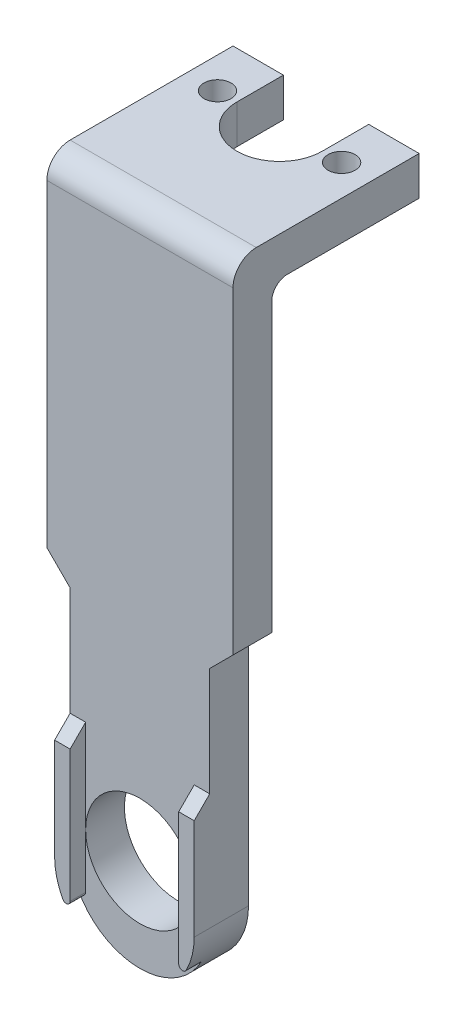
from build123d import *

# Parameters (mm, degrees)
SKETCH1_R           = 5.5
SKETCH1_R_2         = 1.75
BOSS_EXTRUDE2_DEPTH = 5
SKETCH2_W           = 24
SKETCH2_H           = 5
BOSS_EXTRUDE3_DEPTH = 80
FILLET1_R           = 3
FILLET2_R           = 2
SKETCH3_R           = 7
CUT_EXTRUDE1_DEPTH  = 60
SKETCH4_W           = 24
SKETCH4_H           = 2
CUT_EXTRUDE2_DEPTH  = 88.709748603
SKETCH5_W           = 11
SKETCH5_H           = 6
CUT_EXTRUDE3_DEPTH  = 88.709748603
CUT_EXTRUDE4_DEPTH  = 85.380092439
FILLET4_R           = 9
BOSS_EXTRUDE4_DEPTH = 2
CHAMFER1_SIZE       = 2
FILLET5_R           = 0.5


with BuildPart() as part:
    # Sketch1 → Boss-Extrude2 (new body)
    with BuildSketch(Plane(origin=(0, 0, 0), x_dir=(1, 0, 0), z_dir=(0, 1, 0))):
        Polygon((-12, 8), (-12, -18), (12, -18), (12, 5.5), (12, 8), (0, 8), align=None)
        with Locations(Location((0, 0, 0), (0, 0, 270))):
            Circle(SKETCH1_R, mode=Mode.SUBTRACT)
        with Locations(Location((-8, 0, 0), (0, 0, 270))):
            Circle(SKETCH1_R_2, mode=Mode.SUBTRACT)
        with Locations(Location((8, 0, 0), (0, 0, 270))):
            Circle(SKETCH1_R_2, mode=Mode.SUBTRACT)
    extrude(amount=BOSS_EXTRUDE2_DEPTH)

    # Sketch2 → Boss-Extrude3 (add)
    with BuildSketch(Plane.XZ):
        with Locations((0, 15.5)):
            Rectangle(SKETCH2_W, SKETCH2_H)
    extrude(amount=BOSS_EXTRUDE3_DEPTH)

    # Fillet1
    fillet1_edges = [part.edges().sort_by_distance(p)[0] for p in [
        (0, 5, 18),
    ]]
    fillet(fillet1_edges, radius=FILLET1_R)

    # Fillet2
    fillet2_edges = [part.edges().sort_by_distance(p)[0] for p in [
        (0, 0, 13),
    ]]
    fillet(fillet2_edges, radius=FILLET2_R)

    # Sketch3 → Cut-Extrude1 (cut)
    with BuildSketch(Plane.XY.offset(18)):
        with Locations((0, -68)):
            Circle(SKETCH3_R)
    extrude(amount=-CUT_EXTRUDE1_DEPTH, mode=Mode.SUBTRACT)

    # Sketch4 → Cut-Extrude2 (cut, through all)
    with BuildSketch(Plane(origin=(0, 5, 0), x_dir=(1, 0, 0), z_dir=(0, 1, 0))):
        with Locations((0, 7)):
            Rectangle(SKETCH4_W, SKETCH4_H)
    extrude(amount=-CUT_EXTRUDE2_DEPTH, mode=Mode.SUBTRACT)

    # Sketch5 → Cut-Extrude3 (cut, through all)
    with BuildSketch(Plane(origin=(0, 5, 0), x_dir=(1, 0, 0), z_dir=(0, 1, 0))):
        with Locations((0, 3)):
            Rectangle(SKETCH5_W, SKETCH5_H)
    extrude(amount=-CUT_EXTRUDE3_DEPTH, mode=Mode.SUBTRACT)

    # Sketch6 → Cut-Extrude4 (cut, through all)
    with BuildSketch(Plane.XY.offset(18)):
        Polygon((-12, -39), (-9, -42), (-9, -80), (-12, -80), align=None)
        Polygon((9, -80), (12, -80), (12, -39), (9, -42), align=None)
    extrude(amount=-CUT_EXTRUDE4_DEPTH, mode=Mode.SUBTRACT)

    # Fillet4
    fillet4_edges = [part.edges().sort_by_distance(p)[0] for p in [
        (9, -80, 15.5),
        (-9, -80, 15.5),
    ]]
    fillet(fillet4_edges, radius=FILLET4_R - 0.0001)  # a hair under: the kernel refuses the full size

    # Sketch7 → Boss-Extrude4 (add)
    with BuildSketch(Plane.XY.offset(18)):
        with BuildLine():
            Line((-7, -58), (-7, -76.656854249))
            ThreePointArc((-7, -76.656854249), (-8.485281374, -74), (-9, -71))
            Line((-9, -71), (-9, -58))
            Line((-9, -58), (-7, -58))
        make_face()
        with BuildLine():
            Line((7, -58), (9, -58))
            Line((9, -58), (9, -71))
            ThreePointArc((9, -71), (8.485281374, -74), (7, -76.656854249))
            Line((7, -76.656854249), (7, -58))
        make_face()
    extrude(amount=BOSS_EXTRUDE4_DEPTH)

    # Chamfer1
    chamfer1_edges = [part.edges().sort_by_distance(p)[0] for p in [
        (8, -58, 18),
        (-8, -58, 18),
    ]]
    chamfer(chamfer1_edges, length=CHAMFER1_SIZE - 0.0001)  # a hair under: the kernel refuses the full size

    # Fillet5
    fillet5_edges = [part.edges().sort_by_distance(p)[0] for p in [
        (-7, -76.656854249, 19),
        (7, -76.656854249, 19),
    ]]
    fillet(fillet5_edges, radius=FILLET5_R)


solid = part.part
